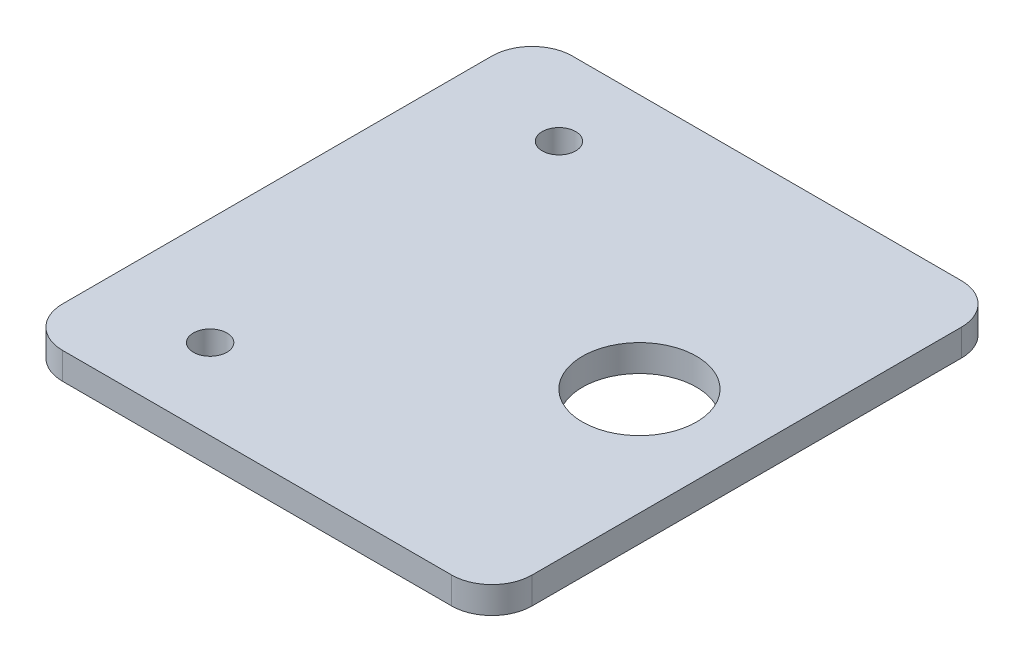
from build123d import *

# Parameters (mm, degrees)
SKETCH1_W                        = 35
SKETCH1_H                        = 38
BASE_FLANGE1_DEPTH               = 2
TAP_DRILL_FOR_M3X0_5_TAP1_D      = 2.5
FILLET1_R                        = 3
TAP_DRILL_FOR_M10X1_5_TAP1_D     = 8.5
TAP_DRILL_FOR_M10X1_5_TAP1_DEPTH = 5
TAP_DRILL_FOR_M10X1_5_TAP1_TIP   = 2.553657631


# Sheet-metal steps are written as plain solids
with BuildPart() as part:
    # Sketch1 → Base-Flange1 (new body)
    with BuildSketch(Plane(origin=(0, 0, 0), x_dir=(1, 0, 0), z_dir=(0, 1, 0))):
        Rectangle(SKETCH1_W, SKETCH1_H)
    extrude(amount=-BASE_FLANGE1_DEPTH)

    # Tap Drill for M3x0.5 Tap1 (through all)
    with Locations(Plane(origin=(0, 0, 0), x_dir=(1, 0, 0), z_dir=(0, 1, 0))):
        with Locations((-9.5, -13), (-9.5, 13)):
            Hole(TAP_DRILL_FOR_M3X0_5_TAP1_D / 2)

    # Fillet1
    fillet1_edges = [part.edges().sort_by_distance(p)[0] for p in [
        (-17.5, -1, -19),
        (17.5, -1, -19),
        (17.5, -1, 19),
        (-17.5, -1, 19),
    ]]
    fillet(fillet1_edges, radius=FILLET1_R)

    # Tap Drill for M10x1.5 Tap1
    with Locations(Plane(origin=(0, 0, 0), x_dir=(1, 0, 0), z_dir=(0, 1, 0))):
        with Locations((9.5, 0)):
            Hole(TAP_DRILL_FOR_M10X1_5_TAP1_D / 2, depth=TAP_DRILL_FOR_M10X1_5_TAP1_DEPTH)
            with Locations((0, 0, -(TAP_DRILL_FOR_M10X1_5_TAP1_DEPTH + TAP_DRILL_FOR_M10X1_5_TAP1_TIP / 2))):  # 118° drill point
                Cone(0, TAP_DRILL_FOR_M10X1_5_TAP1_D / 2, TAP_DRILL_FOR_M10X1_5_TAP1_TIP, mode=Mode.SUBTRACT)


solid = part.part
